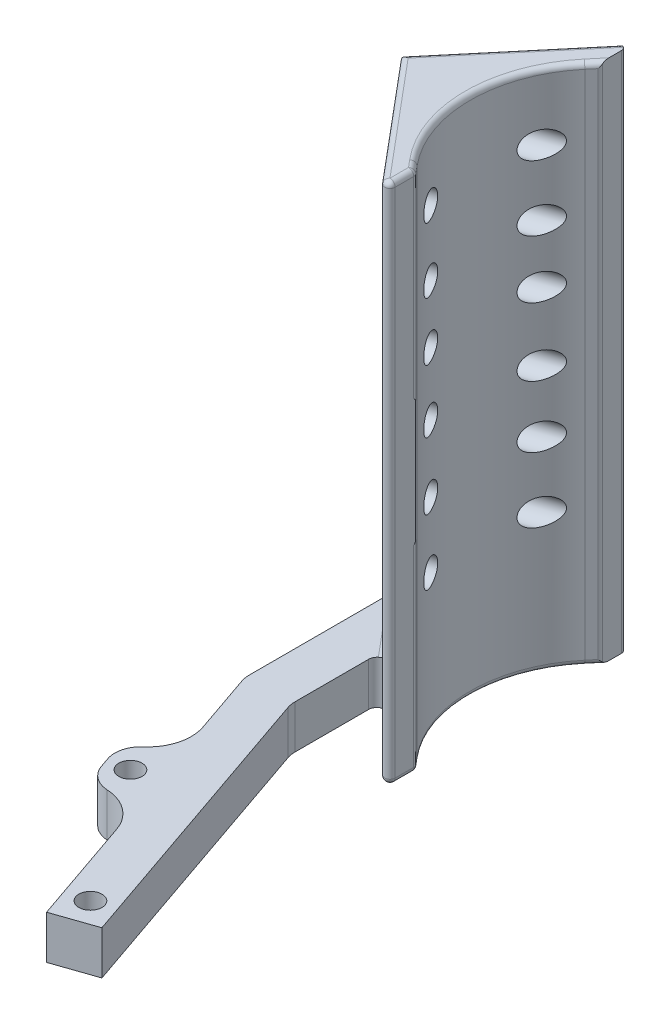
from build123d import *

# Parameters (mm, degrees)
BOSS_EXTRUDE1_DEPTH = 76.2
SKETCH7_R           = 3.3782000000000023
BOSS_EXTRUDE4_DEPTH = 6.35
FILLET2_R           = 12.7
FILLET3_R           = 7.62
CUT_EXTRUDE2_DEPTH  = 17.78
FILLET7_R           = 1.524
SKETCH10_R          = 3.81
SKETCH10_R_2        = 3.8099999999999983
SKETCH10_R_3        = 3.8099999999999996
CUT_EXTRUDE3_DEPTH  = 161.1763589941299
CUT_EXTRUDE4_DEPTH  = 207.86860827995116
BOSS_EXTRUDE5_DEPTH = 12.7
FILLET4_R           = 7.619999999999998
FILLET5_R           = 2.54
LPATTERN1_START     = -1.498714856
LPATTERN1_OUTLINE_R = 3.81
LPATTERN1_DEPTH     = 31.455078701
LPATTERN2_START     = -1.498714856
LPATTERN2_OUTLINE_R = 3.81
LPATTERN2_DEPTH     = 26.498714856
SKETCH14_R          = 3.3782000000000023
CUT_EXTRUDE5_DEPTH  = 203.03625901788195


with BuildPart() as part:
    # Sketch1 → Boss-Extrude1 (new, symmetric)
    with BuildSketch(Plane(origin=(0, 0, 0), x_dir=(1, 0, 0), z_dir=(0, 1, 0))):
        with BuildLine():
            Line((20.549724440726642, 24.49020792905711), (0, 0))
            Line((0, 0), (11.63601772355976, 0))
            ThreePointArc((11.63601772355976, 1.4948e-12), (13.933728871616893, 13.030967460708652), (20.549724440726653, 24.4902079290571))
        make_face()
        with BuildLine():
            Line((11.63601772355976, 0), (0, 0))
            Line((0, 0), (20.54972444072665, -24.490207929057117))
            ThreePointArc((20.549724440726656, -24.490207929057103), (13.933728871616381, -13.030967460707252), (11.63601772355976, 1.4948e-12))
        make_face()
        Polygon((20.54972444072665, -24.490207929057117), (0, 0), (20.549724440726642, 24.49020792905711), (40.45516360535304, 48.2125865656662), (40.45516360535304, 58.372586565666204), (-8.525252252761156, 0), (40.45516360535304, -58.372586565666204), (40.45516360535304, -48.2125865656662), align=None)
    extrude(amount=BOSS_EXTRUDE1_DEPTH, both=True)

    # Sketch9 → Cut-Extrude2 (cut)
    with BuildSketch(Plane(origin=(40.45516360535304, 0, 0), x_dir=(-5.46e-15, 0, -1), z_dir=(1, 0, -5.46e-15))):
        Polygon((-58.372586565666204, 76.2), (-58.372586565666445, 19.05000000000001), (58.37258656566592, 19.049999999999997), (58.372586565666204, 76.2), align=None)
        Polygon((58.372586565666204, -76.2), (-58.372586565666204, -76.2), (-58.372586565666445, -19.05000000000001), (58.372586565665976, -19.049999999999997), align=None)
    extrude(amount=-CUT_EXTRUDE2_DEPTH, mode=Mode.SUBTRACT)

    # Fillet7
    fillet7_edges = [part.edges().sort_by_distance(p)[0] for p in [
        (11.636017723559753, -76.2, 1.78e-15),
        (21.61244402303992, -76.2, 25.756707809199177),
        (21.61244402303977, 76.2, -25.756707809199003),
        (7.0749556762960495, -76.2, 18.591603844670665),
        (7.074955676295836, -76.2, -18.591603844670416),
        (22.675163605353216, -76.2, 32.103207689341296),
        (31.565163605353117, -19.05000000000001, 37.617897127503724),
        (31.565163605352833, -19.049999999999997, -37.617897127503376),
        (31.565163605352772, -19.049999999999997, -47.77789712750332),
        (31.56516360535315, -19.05000000000001, 47.77789712750376),
        (22.675163605352893, -47.625, -27.023207689340893),
        (22.67516360535319, -47.625, 27.02320768934124),
        (22.67516360535325, -47.625, 37.18320768934133),
        (22.675163605352836, -47.625, -37.18320768934084),
        (21.612444023039924, 76.2, 25.756707809199185),
        (7.074955676295836, 76.2, -18.591603844670416),
        (7.0749556762960495, 76.2, 18.591603844670665),
        (22.675163605353216, 76.2, 32.103207689341296),
        (40.45516360535304, 0, 48.2125865656662),
        (40.45516360535304, 0, 58.372586565666204),
        (40.45516360535304, 0, -58.372586565666204),
        (40.45516360535304, 0, -48.2125865656662),
        (31.565163605353117, 19.05000000000001, 37.617897127503724),
        (31.565163605352833, 19.049999999999997, -37.617897127503376),
        (31.565163605352772, 19.049999999999997, -47.77789712750332),
        (31.56516360535315, 19.05000000000001, 47.77789712750376),
        (22.675163605352893, 47.625, -27.023207689340893),
        (22.67516360535319, 47.625, 27.023207689341245),
        (22.67516360535325, 47.625, 37.18320768934133),
        (22.675163605352836, 47.625, -37.18320768934083),
        (11.63601772355976, 76.2, 8.44e-15),
        (21.612444023039767, -76.2, -25.756707809199),
    ]]
    fillet(fillet7_edges, radius=FILLET7_R)

    # Sketch10 → Cut-Extrude3 (cut, through all)
    with BuildSketch(Plane(origin=(-21.695642678518016, 0, 7.470408862279525), x_dir=(0.3255681544571574, 0, 0.9455185755993166), z_dir=(-0.9455185755993167, 0, 0.3255681544571574))):
        with Locations((18.77551604454291, 37.949858361094414)):
            Circle(SKETCH10_R)
        with Locations((18.77551604454291, 21.05949886517079)):
            Circle(SKETCH10_R)
        with Locations((18.77551604454291, -16.78345848645559)):
            Circle(SKETCH10_R)
        with Locations((-10.528439850559355, 21.05949886517079)):
            Circle(SKETCH10_R_2)
        with Locations((-10.528439850559355, -16.78345848645559)):
            Circle(SKETCH10_R_2)
        with Locations((-10.528439850559355, 37.94985836109442)):
            Circle(SKETCH10_R_2)
        with Locations((18.77551604454291, 2.709685530561501)):
            Circle(SKETCH10_R)
        with Locations((-10.528439850559355, 1.228010518147471)):
            Circle(SKETCH10_R_3)
    extrude(amount=-CUT_EXTRUDE3_DEPTH, mode=Mode.SUBTRACT)

    # Sketch11 → Cut-Extrude4 (cut, through all)
    with BuildSketch(Plane.XZ.offset(76.2)):
        with BuildLine():
            Line((22.675163605353198, 27.023207689341266), (22.67516360535322, 32.99605210209241))
            ThreePointArc((22.67516360535322, 32.99605210209241), (22.53237667279708, 33.64012233298526), (22.130771922515507, 34.16350383340576))
            ThreePointArc((22.130771922515507, 34.16350383340576), (21.01833825340579, 34.514252821984265), (19.9837118740399, 33.97566041925472))
            Line((19.9837118740399, 33.97566041925472), (26.31389732943285, 56.45404767118026))
            Line((26.31389732943285, 56.45404767118026), (48.83969440759216, 57.85606823621093))
            Line((48.83969440759216, 57.85606823621093), (28.593497260932818, 19.828475438414188))
            Line((28.593497260932818, 19.828475438414188), (22.675163605353198, 27.023207689341266))
        make_face()
        with BuildLine():
            Line((22.675163605352882, -29.394130801476148), (22.675163605352893, -27.577898326362583))
            ThreePointArc((22.675163605352893, -27.577898326362583), (22.583255159430617, -27.056659627934263), (22.318615336666213, -26.598290009200294))
            Line((22.318615336666213, -26.598290009200294), (28.593497260932818, -25.658597758627057))
            Line((28.593497260932818, -25.658597758627057), (47.75827321164877, -48.74744649791693))
            Line((47.75827321164877, -48.74744649791693), (35.68428809110269, -59.90352631690102))
            Line((35.68428809110269, -59.90352631690102), (19.983711874039535, -33.97566041925429))
            ThreePointArc((19.983711874039535, -33.97566041925429), (21.018338253405428, -34.514252821983824), (22.130771922515148, -34.16350383340533))
            ThreePointArc((22.130771922515148, -34.16350383340533), (22.532376672796712, -33.64012233298484), (22.67516360535286, -32.99605210209202))
            Line((22.67516360535286, -32.99605210209202), (22.675163605352882, -29.394130801476148))
        make_face()
    extrude(amount=-CUT_EXTRUDE4_DEPTH, mode=Mode.SUBTRACT)



with BuildPart() as body_2:
    # Sketch7 → Boss-Extrude4 (new, symmetric)
    with BuildSketch(Plane(origin=(0, -64.897, 0), x_dir=(1, 0, 0), z_dir=(0, 1, 0))):
        Polygon((21.84145341943955, -133.91131693238515), (6.956477397658354, -90.68220765598439), (-5.051608512452955, -94.81692321759029), (-10.013267186380077, -80.40722012545672), (1.9948187237312223, -76.27250456385079), (-8.525252252761147, -45.720000000000006), (4.90653039830957, -45.720000000000006), (33.849539329550865, -129.77660137077922), align=None)
        with Locations(Location((25.36466703753167, -124.6391076055154, 0), (0, 0, 90))):
            Circle(SKETCH7_R, mode=Mode.SUBTRACT)
    extrude(amount=BOSS_EXTRUDE4_DEPTH, both=True)

    # Fillet2
    fillet2_edges = [body_2.edges().sort_by_distance(p)[0] for p in [
        (1.9948187237312223, -64.897, 76.27250456385079),
        (6.956477397658354, -64.897, 90.68220765598439),
    ]]
    fillet(fillet2_edges, radius=FILLET2_R - 0.0001)  # a hair under: the kernel refuses the full size

    # Fillet3
    fillet3_edges = [body_2.edges().sort_by_distance(p)[0] for p in [
        (-10.013267186380077, -64.897, 80.40722012545672),
        (-5.051608512452955, -64.897, 94.81692321759029),
    ]]
    fillet(fillet3_edges, radius=FILLET3_R)


with BuildPart() as part_1:
    add(part.part)

    add(body_2.part)  # Boss-Extrude5 merges body 2
    # Sketch12 → Boss-Extrude5 (add)
    with BuildSketch(Plane.XZ.offset(71.247)):
        Polygon((4.906530398309572, 45.720000000000006), (4.906530398309572, 13.636452117222904), (-6.535811543818767, -1.9e-15), (-8.525252252761153, 0), (-8.525252252761147, 45.720000000000006), align=None)
    extrude(amount=-BOSS_EXTRUDE5_DEPTH)

    # Fillet4
    fillet4_edges = [part_1.edges().sort_by_distance(p)[0] for p in [
        (4.90653039830957, -64.897, 45.720000000000006),
        (-8.525252252761147, -64.897, 45.720000000000006),
    ]]
    fillet(fillet4_edges, radius=FILLET4_R)

    # Fillet5
    fillet5_edges = [part_1.edges().sort_by_distance(p)[0] for p in [
        (4.906530398309575, -64.89699999999999, 16.007375229358175),
        (-1.8093609272257907, -71.247, 8.003687614679087),
        (-1.8093609272257907, -58.547, 8.003687614679087),
    ]]
    fillet(fillet5_edges, radius=FILLET5_R)

    # LPattern1: read off the stored shape, not the designer's step
    # LPattern1 outline → LPattern1 (cut)
    with BuildSketch(Plane(origin=(0, 0, 0), x_dir=(0, 1, 0), z_dir=(0.9455185755993167, 0, -0.3255681544571569)).offset(LPATTERN1_START)):
        with Locations((56.999858361, 18.775516045)):
            Circle(LPATTERN1_OUTLINE_R)
        with Locations((56.999858361, -10.528439851)):
            Circle(LPATTERN1_OUTLINE_R)
    extrude(amount=LPATTERN1_DEPTH, mode=Mode.SUBTRACT)

    # LPattern2: read off the stored shape, not the designer's step
    # LPattern2 outline → LPattern2 (cut)
    with BuildSketch(Plane(origin=(0, 0, 0), x_dir=(0, 1, 0), z_dir=(0.9455185755993167, 0, -0.3255681544571569)).offset(LPATTERN2_START)):
        with Locations((-35.833458486, 18.775516045)):
            Circle(LPATTERN2_OUTLINE_R)
        with Locations((-35.833458486, -10.528439851)):
            Circle(LPATTERN2_OUTLINE_R)
    extrude(amount=LPATTERN2_DEPTH, mode=Mode.SUBTRACT)

    # Sketch14 → Cut-Extrude5 (cut, through all)
    with BuildSketch(Plane.XZ.offset(71.247)):
        with Locations(Location((-1.9126536434844283, 85.67702478869198, 0), (0, 0, 270))):
            Circle(SKETCH14_R)
    extrude(amount=-CUT_EXTRUDE5_DEPTH, mode=Mode.SUBTRACT)


solid = part_1.part
